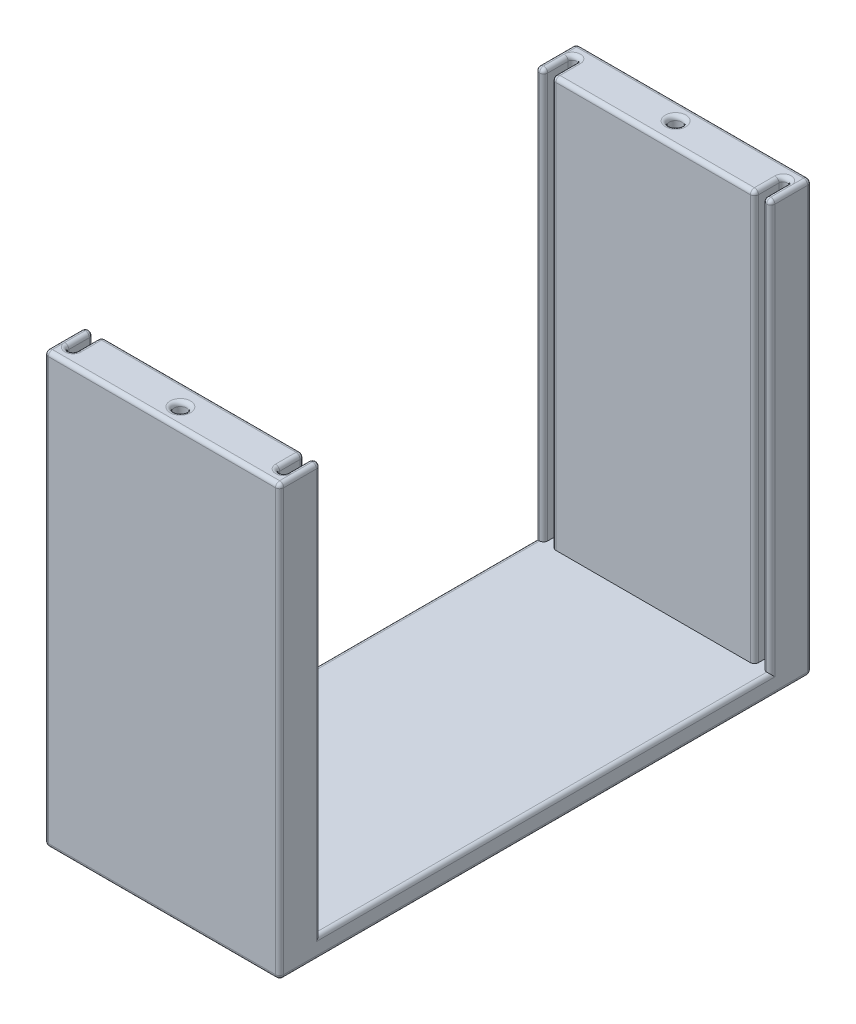
from build123d import *

# Parameters (mm, degrees)
SKETCH4_W           = 57.5
SKETCH4_H           = 130
SKETCH4_R           = 1.5
BOSS_EXTRUDE3_DEPTH = 5
SKETCH5_R           = 1.5
BOSS_EXTRUDE4_DEPTH = 100
FILLET2_R           = 1


with BuildPart() as part:
    # Sketch4 → Boss-Extrude3 (new body)
    with BuildSketch(Plane(origin=(0, 0, 0), x_dir=(1, 0, 0), z_dir=(0, 1, 0))):
        Rectangle(SKETCH4_W, SKETCH4_H)
        with Locations(Location((0, -60.5, 0), (0, 0, 270))):
            Circle(SKETCH4_R, mode=Mode.SUBTRACT)
        with Locations(Location((0, 60.5, 0), (0, 0, 90))):
            Circle(SKETCH4_R, mode=Mode.SUBTRACT)
    extrude(amount=BOSS_EXTRUDE3_DEPTH)

    # Sketch5 → Boss-Extrude4 (add)
    # profile 1 of 2: a face of its own
    with BuildSketch(Plane(origin=(0, 5, 0), x_dir=(1, 0, 0), z_dir=(0, 1, 0))):
        with BuildLine():
            Line((27.75, -55), (28.75, -55))
            Line((28.75, -55), (28.75, -65))
            Line((28.75, -65), (-28.75, -65))
            Line((-28.75, -65), (-28.75, -55))
            Line((-28.75, -55), (-27.75, -55))
            ThreePointArc((-27.75, -55), (-27.042893219, -55.292893219), (-26.75, -56))
            Line((-26.75, -56), (-26.75, -61))
            ThreePointArc((-26.75, -61), (-25.75, -62), (-24.75, -61))
            Line((-24.75, -61), (-24.75, -56))
            ThreePointArc((-24.75, -56), (-24.457106781, -55.292893219), (-23.75, -55))
            Line((-23.75, -55), (23.75, -55))
            ThreePointArc((23.75, -55), (24.457106781, -55.292893219), (24.75, -56))
            Line((24.75, -56), (24.75, -61))
            ThreePointArc((24.75, -61), (25.75, -62), (26.75, -61))
            Line((26.75, -61), (26.75, -56))
            ThreePointArc((26.75, -56), (27.042893219, -55.292893219), (27.75, -55))
        make_face()
        with Locations(Location((0, -60.5, 0), (0, 0, 270))):
            Circle(SKETCH5_R, mode=Mode.SUBTRACT)
    # profile 2 of 2: a face of its own
    with BuildSketch(Plane(origin=(0, 5, 0), x_dir=(1, 0, 0), z_dir=(0, 1, 0))):
        with BuildLine():
            Line((28.75, 65), (28.75, 55))
            Line((28.75, 55), (27.75, 55))
            ThreePointArc((27.75, 55), (27.042893219, 55.292893219), (26.75, 56))
            Line((26.75, 56), (26.75, 61))
            ThreePointArc((26.75, 61), (25.75, 62), (24.75, 61))
            Line((24.75, 61), (24.75, 56))
            ThreePointArc((24.75, 56), (24.457106781, 55.292893219), (23.75, 55))
            Line((23.75, 55), (-23.75, 55))
            ThreePointArc((-23.75, 55), (-24.457106781, 55.292893219), (-24.75, 56))
            Line((-24.75, 56), (-24.75, 61))
            ThreePointArc((-24.75, 61), (-25.75, 62), (-26.75, 61))
            Line((-26.75, 61), (-26.75, 56))
            ThreePointArc((-26.75, 56), (-27.042893219, 55.292893219), (-27.75, 55))
            Line((-27.75, 55), (-28.75, 55))
            Line((-28.75, 55), (-28.75, 65))
            Line((-28.75, 65), (28.75, 65))
        make_face()
        with Locations(Location((0, 60.5, 0), (0, 0, 90))):
            Circle(SKETCH5_R, mode=Mode.SUBTRACT)
    extrude(amount=BOSS_EXTRUDE4_DEPTH)

    # Fillet2
    fillet2_edges = [part.edges().sort_by_distance(p)[0] for p in [
        (0, 0, -59),
        (0, 0, 59),
        (0, 105, 59),
        (-27.042893219, 105, 55.292893219),
        (-26.75, 105, 58.5),
        (-24.75, 105, 58.5),
        (-24.457106781, 105, 55.292893219),
        (0, 105, 55),
        (24.457106781, 105, 55.292893219),
        (24.75, 105, 58.5),
        (26.75, 105, 58.5),
        (27.042893219, 105, 55.292893219),
        (0, 105, 65),
        (0, 0, 65),
        (-28.75, 55, -55),
        (-28.75, 5, 0),
        (-28.75, 55, 55),
        (-28.75, 105, 60),
        (-28.75, 52.5, 65),
        (-28.75, 0, 0),
        (0, 105, -59),
        (27.042893219, 105, -55.292893219),
        (26.75, 105, -58.5),
        (24.75, 105, -58.5),
        (24.457106781, 105, -55.292893219),
        (0, 105, -55),
        (-24.457106781, 105, -55.292893219),
        (-24.75, 105, -58.5),
        (-26.75, 105, -58.5),
        (-27.042893219, 105, -55.292893219),
        (-28.75, 105, -60),
        (0, 105, -65),
        (-28.75, 52.5, -65),
        (0, 0, -65),
        (28.75, 52.5, 65),
        (28.75, 105, 60),
        (28.75, 55, 55),
        (28.75, 5, 0),
        (28.75, 55, -55),
        (28.75, 105, -60),
        (28.75, 52.5, -65),
        (28.75, 0, 0),
        (-25.75, 105, 62),
        (25.75, 105, 62),
        (25.75, 105, -62),
        (-25.75, 105, -62),
    ]]
    fillet(fillet2_edges, radius=FILLET2_R - 0.0001)  # a hair under: the kernel refuses the full size


solid = part.part
